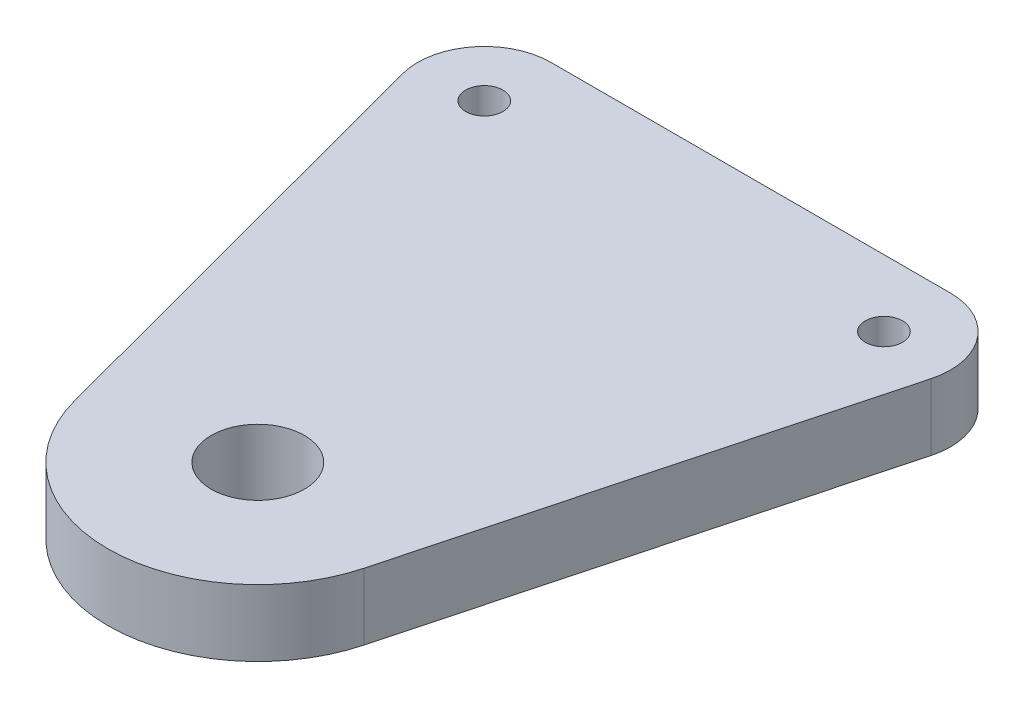
from build123d import *

# Parameters (mm, degrees)
SKETCH1_R           = 3.5
SKETCH1_R_2         = 1.4
BOSS_EXTRUDE1_DEPTH = 5


with BuildPart() as part:
    # Sketch1 → Boss-Extrude1 (new body)
    with BuildSketch(Plane(origin=(0, 0, 0), x_dir=(1, 0, 0), z_dir=(0, 1, 0))):
        with BuildLine():
            Line((-15, 37), (15, 37))
            ThreePointArc((15, 37), (18.964870684, 35.046276491), (19.831236942, 30.711920184))
            Line((19.831236942, 30.711920184), (10.870283119, -2.898179587))
            ThreePointArc((10.870283119, -2.898179587), (0, -11.25), (-10.870283119, -2.898179587))
            Line((-10.870283119, -2.898179587), (-19.831236942, 30.711920184))
            ThreePointArc((-19.831236942, 30.711920184), (-18.964870684, 35.046276491), (-15, 37))
        make_face()
        Circle(SKETCH1_R, mode=Mode.SUBTRACT)
        with Locations((-15, 32)):
            Circle(SKETCH1_R_2, mode=Mode.SUBTRACT)
        with Locations((15, 32)):
            Circle(SKETCH1_R_2, mode=Mode.SUBTRACT)
    extrude(amount=BOSS_EXTRUDE1_DEPTH)


solid = part.part
